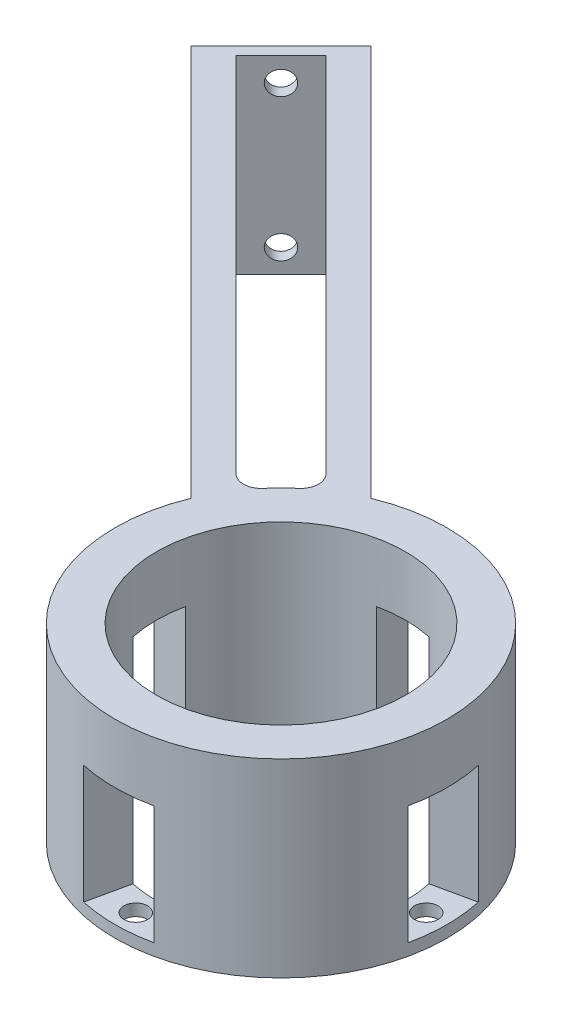
from build123d import *
from build123d.topology import SkipClean

# Parameters (mm, degrees)
SKETCH_1_R          = 28
SKETCH_1_R_2        = 2
SKETCH_1_R_3        = 21
EXTRUDE_1_DEPTH     = 2
EXTRUDE_3_DEPTH     = 30
EXTRUDE_START       = -10
SKETCH_5_R          = 28
SKETCH_5_R_2        = 21
EXTRUDE_4_DEPTH     = 10
SKETCH_6_W          = 5.360290559
SKETCH_6_H          = 32
EXTRUDE_6_DEPTH     = 100
SKETCH_9_R          = 21
CUT_EXTRUDE_1_DEPTH = 32
SKETCH_11_W         = 21.441162236
SKETCH_11_H         = 32
SKETCH_11_R         = 2
EXTRUDE_7_DEPTH     = 2
FILLET_1_R          = 3


with BuildPart() as part:
    # 草图1 → 凸台-拉伸1 (new body)
    with BuildSketch(Plane(origin=(0, 0, 0), x_dir=(1, 0, 0), z_dir=(0, 1, 0))):
        with Locations(Location((0, 0, 0), (0, 0, 270))):
            Circle(SKETCH_1_R)
        with Locations(Location((-24.5, 0, 0), (0, 0, 270))):
            Circle(SKETCH_1_R_2, mode=Mode.SUBTRACT)
        with Locations(Location((0, 24.5, 0), (0, 0, 270))):
            Circle(SKETCH_1_R_2, mode=Mode.SUBTRACT)
        with Locations(Location((24.5, 0, 0), (0, 0, 270))):
            Circle(SKETCH_1_R_2, mode=Mode.SUBTRACT)
        with Locations(Location((0, -24.5, 0), (0, 0, 270))):
            Circle(SKETCH_1_R_2, mode=Mode.SUBTRACT)
        with Locations(Location((0, 0, 0), (0, 0, 270))):
            Circle(SKETCH_1_R_3, mode=Mode.SUBTRACT)
    extrude(amount=EXTRUDE_1_DEPTH)

    # 草图2 → 凸台-拉伸3 (add)
    with SkipClean():  # the faces are left unmerged after this step: merging them gives an invalid solid
        with BuildSketch(Plane(origin=(0, 2, 0), x_dir=(1, 0, 0), z_dir=(0, 1, 0))):
            with BuildLine():
                ThreePointArc((-20.522761723, 4.451544819), (-14.849242405, 14.849242405), (-4.451544819, 20.522761723))
                Line((-4.451544819, 20.522761723), (-5.935393092, 27.363682297))
                ThreePointArc((-5.935393092, 27.363682297), (-19.798989873, 19.798989873), (-27.363682297, 5.935393092))
                Line((-27.363682297, 5.935393092), (-20.522761723, 4.451544819))
            make_face()
            with BuildLine():
                ThreePointArc((5.935393092, -27.363682297), (19.798989873, -19.798989873), (27.363682297, -5.935393092))
                Line((27.363682297, -5.935393092), (20.522761723, -4.451544819))
                ThreePointArc((20.522761723, -4.451544819), (14.849242405, -14.849242405), (4.451544819, -20.522761723))
                Line((4.451544819, -20.522761723), (5.935393092, -27.363682297))
            make_face()
            with BuildLine():
                ThreePointArc((-4.451544819, -20.522761723), (-14.849242405, -14.849242405), (-20.522761723, -4.451544819))
                Line((-20.522761723, -4.451544819), (-27.363682297, -5.935393092))
                ThreePointArc((-27.363682297, -5.935393092), (-19.798989873, -19.798989873), (-5.935393092, -27.363682297))
                Line((-5.935393092, -27.363682297), (-4.451544819, -20.522761723))
            make_face()
            with BuildLine():
                Line((4.451544819, 20.522761723), (5.935393092, 27.363682297))
                ThreePointArc((5.935393092, 27.363682297), (19.798989873, 19.798989873), (27.363682297, 5.935393092))
                Line((27.363682297, 5.935393092), (20.522761723, 4.451544819))
                ThreePointArc((20.522761723, 4.451544819), (14.849242405, 14.849242405), (4.451544819, 20.522761723))
            make_face()
        extrude(amount=EXTRUDE_3_DEPTH)

    # 草图5 → 凸台-拉伸4 (add)
    with SkipClean():  # the faces are left unmerged after this step: merging them gives an invalid solid
        with BuildSketch(Plane(origin=(0, 32, 0), x_dir=(1, 0, 0), z_dir=(0, 1, 0)).offset(EXTRUDE_START)):
            with Locations(Location((0, 0, 0), (0, 0, 270))):
                Circle(SKETCH_5_R)
            with Locations(Location((0, 0, 0), (0, 0, 270))):
                Circle(SKETCH_5_R_2, mode=Mode.SUBTRACT)
        extrude(amount=EXTRUDE_4_DEPTH)

    # 草图6 → 凸台-拉伸6 (add)
    with SkipClean():  # the faces are left unmerged after this step: merging them gives an invalid solid
        with BuildSketch(Plane(origin=(-12.25, 0, -12.25), x_dir=(-0.7071067811865488, 0, 0.7071067811865462), z_dir=(-0.7071067811865462, 0, -0.7071067811865488))):
            with Locations((-8.040435839, 16)):
                Rectangle(SKETCH_6_W, SKETCH_6_H)
            with Locations((8.040435839, 16)):
                Rectangle(SKETCH_6_W, SKETCH_6_H)
        extrude(amount=EXTRUDE_6_DEPTH)

    # 草图9 → 切除-拉伸1 (cut)
    with SkipClean():  # the faces are left unmerged after this step: merging them gives an invalid solid
        with BuildSketch(Plane.XZ):
            with Locations(Location((0, 0, 0), (0, 0, 90))):
                Circle(SKETCH_9_R)
        extrude(amount=-CUT_EXTRUDE_1_DEPTH, mode=Mode.SUBTRACT)
    add(part.part.scale(1), mode=Mode.REPLACE)  # the faces are merged on a copy

    # 草图11 → 凸台-拉伸7 (add)
    with SkipClean():  # the faces are left unmerged after this step: merging them gives an invalid solid
        with BuildSketch(Plane(origin=(-82.960678119, 0, -82.960678119), x_dir=(-0.7071067811865488, 0, 0.7071067811865462), z_dir=(-0.7071067811865462, 0, -0.7071067811865488))):
            with Locations((0, 16)):
                Rectangle(SKETCH_11_W, SKETCH_11_H)
            with Locations((0, 4)):
                Circle(SKETCH_11_R, mode=Mode.SUBTRACT)
            with Locations((0, 28)):
                Circle(SKETCH_11_R, mode=Mode.SUBTRACT)
        extrude(amount=EXTRUDE_7_DEPTH)

    # 圆角1
    fillet_1_edges = [part.edges().sort_by_distance(p)[0] for p in [
        (-15.642500311, 12, -23.223095918),
        (-23.223095918, 12, -15.642500311),
    ]]
    fillet(fillet_1_edges, radius=FILLET_1_R)


solid = part.part
